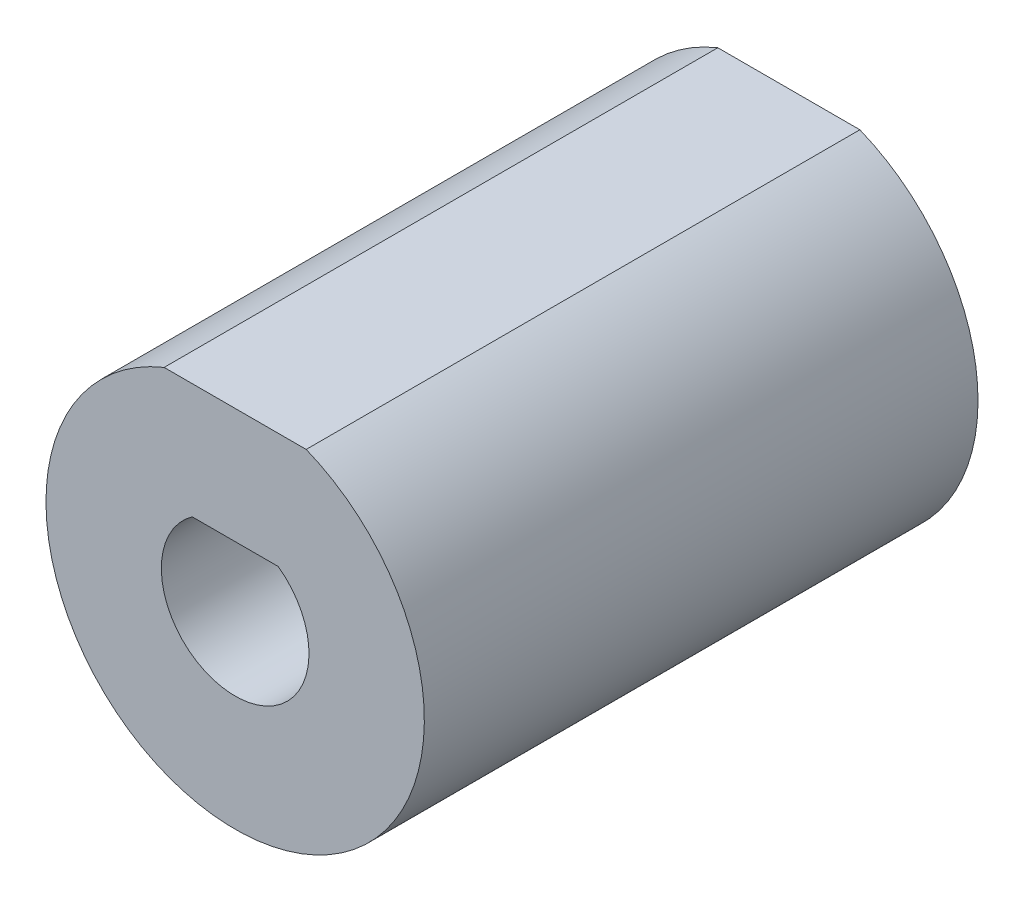
from build123d import *

# Parameters (mm, degrees)
BOSS_EXTRUDE1_DEPTH = 6.35
BOSS_EXTRUDE2_START = 2.54
BOSS_EXTRUDE2_DEPTH = 2.54
BOSS_EXTRUDE4_START = 6.35
SKETCH4_R           = 1.5875
BOSS_EXTRUDE4_DEPTH = 6.35


with BuildPart() as part:
    # Sketch1 → Boss-Extrude1 (new body)
    with BuildSketch(Plane.XY):
        with BuildLine():
            Line((-1.955140148, 4.826), (1.955140148, 4.826))
            ThreePointArc((1.955140148, 4.826), (0, -5.207), (-1.955140148, 4.826))
        make_face()
        with BuildLine():
            Line((-1.18457714, 1.651), (1.18457714, 1.651))
            ThreePointArc((1.18457714, 1.651), (0, -2.032), (-1.18457714, 1.651))
        make_face(mode=Mode.SUBTRACT)
    extrude(amount=BOSS_EXTRUDE1_DEPTH)

    # Sketch3 → Boss-Extrude2 (add)
    with BuildSketch(Plane(origin=(0, 0, 0), x_dir=(-1, 0, 0), z_dir=(0, 0, -1)).offset(BOSS_EXTRUDE2_START)):
        with BuildLine():
            Line((-1.955140148, 4.826), (1.955140148, 4.826))
            ThreePointArc((1.955140148, 4.826), (0, -5.207), (-1.955140148, 4.826))
        make_face()
    extrude(amount=-BOSS_EXTRUDE2_DEPTH)

    # Sketch4 → Boss-Extrude4 (add)
    with BuildSketch(Plane(origin=(0, 0, -2.54), x_dir=(-1, 0, 0), z_dir=(0, 0, -1)).offset(BOSS_EXTRUDE4_START)):
        with BuildLine():
            Line((1.955140148, 4.826), (-1.955140148, 4.826))
            ThreePointArc((-1.955140148, 4.826), (0, -5.207), (1.955140148, 4.826))
        make_face()
        Circle(SKETCH4_R, mode=Mode.SUBTRACT)
    extrude(amount=-BOSS_EXTRUDE4_DEPTH)


solid = part.part
